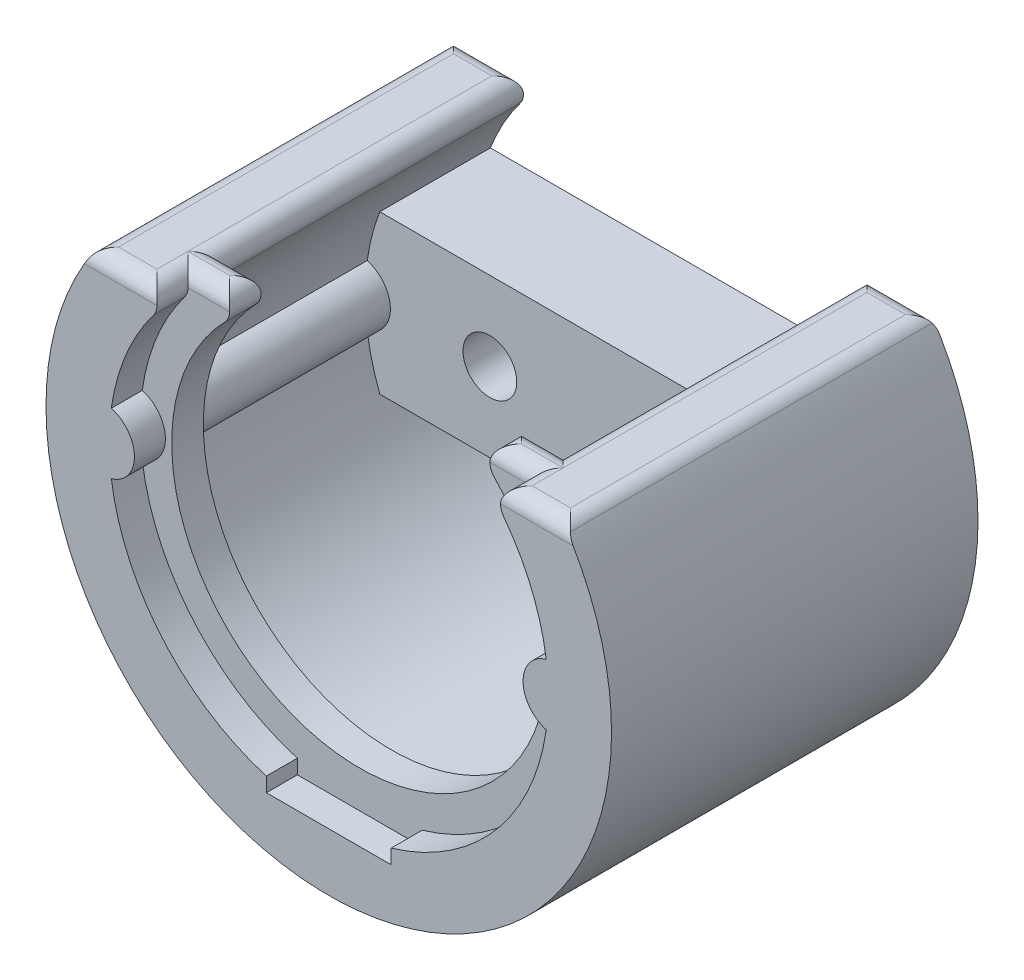
from build123d import *

# Parameters (mm, degrees)
SKETCH_3_R          = 6.95
SKETCH_3_R_2        = 5.95
EXTRUDE_3_DEPTH     = 1
SKETCH_1_R          = 8.95
EXTRUDE_1_DEPTH     = 11.6
CUT_EXTRUDE_1_DEPTH = 18.16872156
FILLET_4_R          = 0.5
SKETCH_5_W          = 17.187495454
SKETCH_5_H          = 5
EXTRUDE_4_DEPTH     = 3.5
SKETCH_6_W          = 0.98
SKETCH_6_H          = 0.456526807
CUT_EXTRUDE_2_DEPTH = 3.95
CUT_EXTRUDE_3_REACH = 19.169
SKETCH_8_R          = 0.85


with BuildPart() as part:
    # 草图3 → 凸台-拉伸3 (new body)
    with BuildSketch(Plane(origin=(0, 0, -0.98), x_dir=(-1, 0, 0), z_dir=(0, 0, -1))):
        with Locations(Location((0, 0, 0), (0, 0, 90))):
            Circle(SKETCH_3_R)
        with Locations(Location((0, 0, 0), (0, 0, 90))):
            Circle(SKETCH_3_R_2, mode=Mode.SUBTRACT)
    extrude(amount=EXTRUDE_3_DEPTH)

    # 草图1 → 凸台-拉伸1 (add)
    with BuildSketch(Plane.XY):
        Circle(SKETCH_1_R)
        with BuildLine():
            ThreePointArc((1.975, 6.663473193), (-3.760818846, 5.844548024), (-6.882867133, 0.963659707))
            ThreePointArc((-6.882867133, 0.963659707), (-6.15, 0), (-6.882867133, -0.963659707))
            ThreePointArc((-6.882867133, -0.963659707), (-3.760818846, -5.844548024), (1.975, -6.663473193))
            ThreePointArc((1.975, -6.663473193), (5.266632793, -4.53487365), (6.882867133, -0.963659707))
            ThreePointArc((6.882867133, -0.963659707), (6.15, 0), (6.882867133, 0.963659707))
            ThreePointArc((6.882867133, 0.963659707), (5.266632793, 4.53487365), (1.975, 6.663473193))
        make_face(mode=Mode.SUBTRACT)
    extrude(amount=-EXTRUDE_1_DEPTH)

    # 草图4 → 切除-拉伸1 (cut, through all)
    with BuildSketch(Plane.XY):
        with BuildLine():
            Line((-7.423105819, 5), (7.423105819, 5))
            ThreePointArc((7.423105819, 5), (0, 8.95), (-7.423105819, 5))
        make_face()
    extrude(amount=-CUT_EXTRUDE_1_DEPTH, mode=Mode.SUBTRACT)

    # 圆角4
    fillet_4_edges = [part.edges().sort_by_distance(p)[0] for p in [
        (6.125186063, 5, -11.6),
        (-6.125186063, 5, 0),
        (6.125186063, 5, 0),
        (4.827266307, 5, -0.49),
        (4.026278496, 5, -0.98),
        (4.827266307, 5, -6.79),
        (7.423105819, 5, -5.8),
        (-4.026278496, 5, -0.98),
        (-4.827266307, 5, -0.49),
        (-6.125186063, 5, -11.6),
        (-4.827266307, 5, -6.79),
        (-7.423105819, 5, -5.8),
        (-3.225290685, 5, -1.48),
        (-4.026278496, 5, -1.98),
        (4.026278496, 5, -1.98),
        (3.225290685, 5, -1.48),
    ]]
    fillet(fillet_4_edges, radius=FILLET_4_R - 0.0001)  # a hair under: the kernel refuses the full size

    # 草图5 → 凸台-拉伸4 (add)
    with BuildSketch(Plane(origin=(0, 0, -11.6), x_dir=(-1, 0, 0), z_dir=(0, 0, -1))):
        Rectangle(SKETCH_5_W, SKETCH_5_H)
    extrude(amount=-EXTRUDE_4_DEPTH)

    # 草图6 → 切除-拉伸2 (cut)
    with BuildSketch(Plane(origin=(1.975, 0, 0), x_dir=(0, 0, -1), z_dir=(1, 0, 0))):
        with Locations((0.49, -6.891736597)):
            Rectangle(SKETCH_6_W, SKETCH_6_H)
    extrude(amount=-CUT_EXTRUDE_2_DEPTH, mode=Mode.SUBTRACT)

    # 草图8 → 切除-拉伸3 (cut, up to next)
    with BuildSketch(Plane(origin=(0, 0, -11.6), x_dir=(-1, 0, 0), z_dir=(0, 0, -1)), mode=Mode.PRIVATE) as cut_extrude_3_sk1:
        with Locations((-3, 0)):
            Circle(SKETCH_8_R)
    cut_extrude_3_tool1 = extrude(cut_extrude_3_sk1.sketch, amount=-CUT_EXTRUDE_3_REACH, mode=Mode.PRIVATE) & part.part
    # 草图8 → 切除-拉伸3 (cut, up to next)
    with BuildSketch(Plane(origin=(0, 0, -11.6), x_dir=(-1, 0, 0), z_dir=(0, 0, -1)), mode=Mode.PRIVATE) as cut_extrude_3_sk2:
        with Locations((3, 0)):
            Circle(SKETCH_8_R)
    cut_extrude_3_tool2 = extrude(cut_extrude_3_sk2.sketch, amount=-CUT_EXTRUDE_3_REACH, mode=Mode.PRIVATE) & part.part
    add(cut_extrude_3_tool1.solids().sort_by_distance((3, 0, -11.6))[0], mode=Mode.SUBTRACT)
    add(cut_extrude_3_tool2.solids().sort_by_distance((-3, 0, -11.6))[0], mode=Mode.SUBTRACT)


solid = part.part
